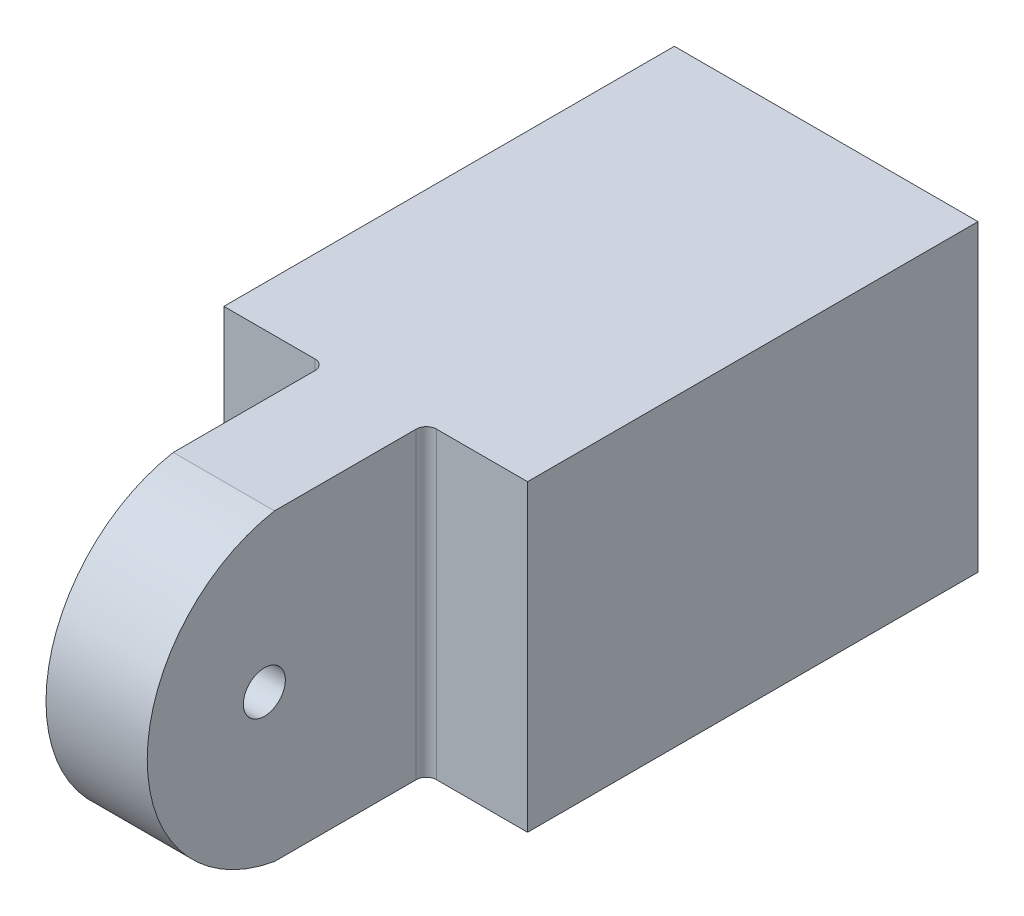
from build123d import *

# Parameters (mm, degrees)
SKETCH2_W           = 60
SKETCH2_H           = 60
BOSS_EXTRUDE1_DEPTH = 89
SKETCH3_W           = 20
SKETCH3_H           = 60
BOSS_EXTRUDE2_DEPTH = 30
BOSS_EXTRUDE3_DEPTH = 20
FILLET1_R           = 2
SKETCH7_W           = 50
SKETCH7_H           = 50
CUT_EXTRUDE1_DEPTH  = 81
SKETCH8_R           = 4.15
CUT_EXTRUDE2_DEPTH  = 153.570263572


with BuildPart() as part:
    # Sketch2 → Boss-Extrude1 (new body)
    with BuildSketch(Plane.XY):
        Rectangle(SKETCH2_W, SKETCH2_H)
    extrude(amount=BOSS_EXTRUDE1_DEPTH)

    # Sketch3 → Boss-Extrude2 (add)
    with BuildSketch(Plane.XY.offset(89)):
        Rectangle(SKETCH3_W, SKETCH3_H)
    extrude(amount=BOSS_EXTRUDE2_DEPTH)

    # Sketch4 → Boss-Extrude3 (add)
    with BuildSketch(Plane(origin=(10, 0, 0), x_dir=(0, 0, -1), z_dir=(1, 0, 0))):
        with BuildLine():
            Line((-119, -30), (-119, 30))
            ThreePointArc((-119, 30), (-144.144668047, 0), (-119, -30))
        make_face()
    extrude(amount=-BOSS_EXTRUDE3_DEPTH)

    # Fillet1
    fillet1_edges = [part.edges().sort_by_distance(p)[0] for p in [
        (10, 0, 89),
        (-10, 0, 89),
    ]]
    fillet(fillet1_edges, radius=FILLET1_R)

    # Sketch7 → Cut-Extrude1 (cut)
    with BuildSketch(Plane(origin=(0, 0, 0), x_dir=(-1, 0, 0), z_dir=(0, 0, -1))):
        Rectangle(SKETCH7_W, SKETCH7_H)
    extrude(amount=-CUT_EXTRUDE1_DEPTH, mode=Mode.SUBTRACT)

    # Sketch8 → Cut-Extrude2 (cut, through all)
    with BuildSketch(Plane.ZY.offset(10)):
        with Locations((121, 0)):
            Circle(SKETCH8_R)
    extrude(amount=-CUT_EXTRUDE2_DEPTH, mode=Mode.SUBTRACT)


solid = part.part
